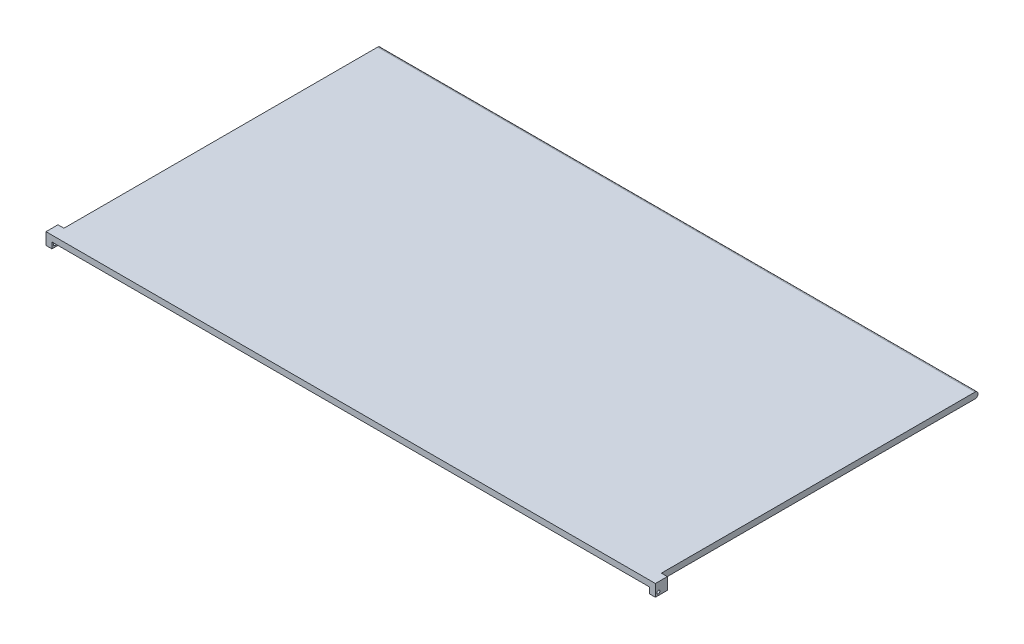
from build123d import *

# Parameters (mm, degrees)
SKETCH1_W           = 200
SKETCH1_H           = 110
BOSS_EXTRUDE1_DEPTH = 2
FILLET1_R           = 1
SKETCH3_W           = 4
SKETCH3_H           = 4
SKETCH3_R           = 0.5
BOSS_EXTRUDE2_DEPTH = 2
BOSS_EXTRUDE3_START = 2
SKETCH4_W           = 4
SKETCH4_H           = 4
SKETCH4_R           = 0.5
BOSS_EXTRUDE3_DEPTH = 2


with BuildPart() as part:
    # Sketch1 → Boss-Extrude1 (new body)
    with BuildSketch(Plane(origin=(0, 0, 0), x_dir=(1, 0, 0), z_dir=(0, 1, 0))):
        Rectangle(SKETCH1_W, SKETCH1_H)
    extrude(amount=BOSS_EXTRUDE1_DEPTH)

    # Fillet1
    fillet1_edges = [part.edges().sort_by_distance(p)[0] for p in [
        (0, 0, -55),
        (0, 2, -55),
    ]]
    fillet(fillet1_edges, radius=FILLET1_R - 0.0001)  # a hair under: the kernel refuses the full size

    # Sketch3 → Boss-Extrude2 (add)
    with BuildSketch(Plane.ZY.offset(100)):
        with Locations((53, 0)):
            Rectangle(SKETCH3_W, SKETCH3_H)
        with Locations((54, -1.003505598)):
            Circle(SKETCH3_R, mode=Mode.SUBTRACT)
    extrude(amount=BOSS_EXTRUDE2_DEPTH)

    # Sketch4 → Boss-Extrude3 (add)
    with BuildSketch(Plane(origin=(100, 0, 0), x_dir=(0, 0, -1), z_dir=(1, 0, 0)).offset(BOSS_EXTRUDE3_START)):
        with Locations((-53, 0)):
            Rectangle(SKETCH4_W, SKETCH4_H)
        with Locations(Location((-54, -1.003505598, 0), (0, 0, 180))):
            Circle(SKETCH4_R, mode=Mode.SUBTRACT)
    extrude(amount=-BOSS_EXTRUDE3_DEPTH)


solid = part.part
